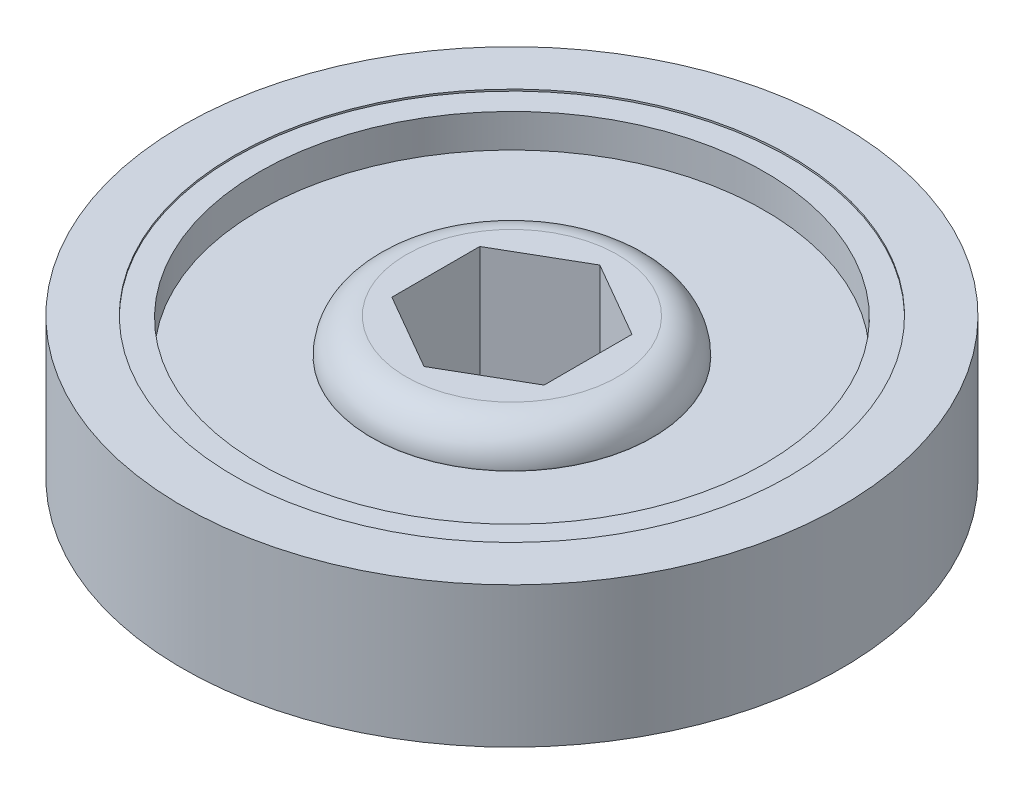
from build123d import *

# Parameters (mm, degrees)
CUT_EXTRUDE1_DEPTH = 36.175217306


with BuildPart() as part:
    # Sketch2 → Revolve1 (revolve)
    with BuildSketch(Plane.XY):
        with BuildLine():
            Line((0, 0), (7.6454, 0))
            ThreePointArc((7.6454, 0), (9.423490712, -0.736509288), (10.16, -2.5146))
            Line((10.16, -2.5146), (10.16, -2.54))
            Line((10.16, -2.54), (18.26278597, -2.54))
            Line((18.26278597, -2.54), (18.26278597, -0.127))
            Line((18.26278597, -0.127), (20.060873779, -0.127))
            Line((20.060873779, -0.127), (20.060873779, 0))
            Line((20.060873779, 0), (23.8125, 0))
            Line((23.8125, 0), (23.8125, -10.16))
            Line((23.8125, -10.16), (20.060873779, -10.16))
            Line((20.060873779, -10.16), (20.060873779, -10.033))
            Line((20.060873779, -10.033), (18.26278597, -10.033))
            Line((18.26278597, -10.033), (18.26278597, -7.62))
            Line((18.26278597, -7.62), (10.16, -7.62))
            Line((10.16, -7.62), (10.16, -7.6454))
            ThreePointArc((10.16, -7.6454), (9.423490712, -9.423490712), (7.6454, -10.16))
            Line((7.6454, -10.16), (0, -10.16))
            Line((0, -10.16), (0, 0))
        make_face()
    revolve(axis=Axis((0, 0, 0), (0, -1, 0)))

    # Sketch3 → Cut-Extrude1 (cut, through all)
    with BuildSketch(Plane(origin=(0, 0, 0), x_dir=(1, 0, 0), z_dir=(0, 1, 0))):
        Polygon((0, 6.35), (-5.499261314, 3.175), (-5.499261314, -3.175), (0, -6.35), (5.499261314, -3.175), (5.499261314, 3.175), align=None)
    extrude(amount=-CUT_EXTRUDE1_DEPTH, mode=Mode.SUBTRACT)


solid = part.part
